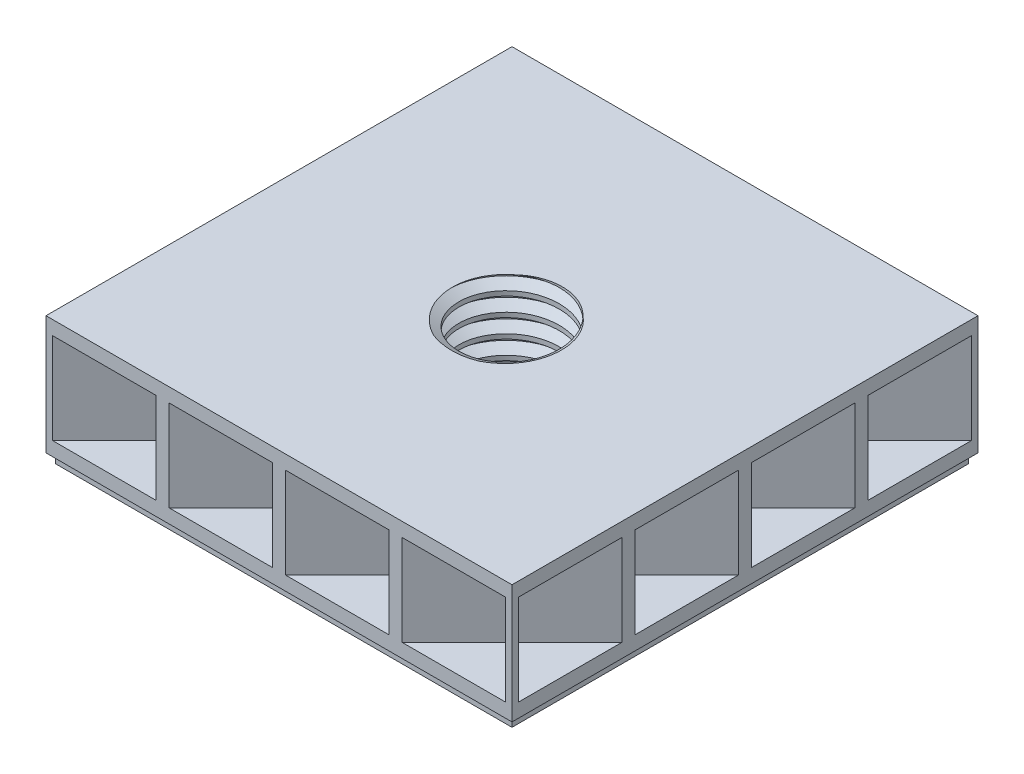
from build123d import *

# Parameters (mm, degrees)
SKETCH1_W                = 20
SKETCH1_H                = 20
SKETCH1_R                = 2.157
MAIN_SQUARE_DEPTH        = 5.5
ANTIWARPCUTS1_DEPTH      = 29.814059068
ANTIWARPCUTS1_DEPTH_BACK = 29.814059068
SKETCH2_W                = 0.2
SKETCH2_H                = 0.4
ANTIWARPCUTS2_DEPTH      = 29.814059068
ANTIWARPCUTS2_DEPTH_BACK = 29.814059068
SKETCH3_W                = 0.2
SKETCH3_H                = 0.4
NOFILL_DEPTH             = 29.814059068
NOFILL_DEPTH_BACK        = 29.814059068
SKETCH5_W                = 20
SKETCH5_H                = 3.9
THREADME_REACH           = 30.64
SKETCH6_R                = 4
SKETCH6_R_2              = 2.157
LATTICE_DEPTH            = 3.9
THREAD1_PITCH            = 0.8


with BuildPart() as part:
    # Sketch1 → Main Square (new body)
    with BuildSketch(Plane(origin=(0, 0, 0), x_dir=(1, 0, 0), z_dir=(0, 1, 0))):
        with Locations((10, 10)):
            Rectangle(SKETCH1_W, SKETCH1_H)
        with Locations(Location((10, 10, 0), (0, 0, 270))):
            Circle(SKETCH1_R, mode=Mode.SUBTRACT)
    extrude(amount=MAIN_SQUARE_DEPTH)

    # Sketch2 → AntiWarpCuts1 (cut, two sides: drawn at the far end of the back side and taken through both)
    with BuildSketch(Plane.XY.offset(-ANTIWARPCUTS1_DEPTH_BACK)):
        with Locations((0.1, 0.2)):
            Rectangle(SKETCH2_W, SKETCH2_H)
        with Locations((19.9, 0.2)):
            Rectangle(SKETCH2_W, SKETCH2_H)
    extrude(amount=ANTIWARPCUTS1_DEPTH + ANTIWARPCUTS1_DEPTH_BACK, mode=Mode.SUBTRACT)

    # Sketch3 → AntiWarpCuts2 (cut, two sides: drawn at the far end of the back side and taken through both)
    with BuildSketch(Plane.ZY.offset(-ANTIWARPCUTS2_DEPTH_BACK)):
        with Locations((-0.1, 0.2)):
            Rectangle(SKETCH3_W, SKETCH3_H)
        with Locations((-19.9, 0.2)):
            Rectangle(SKETCH3_W, SKETCH3_H)
    extrude(amount=ANTIWARPCUTS2_DEPTH + ANTIWARPCUTS2_DEPTH_BACK, mode=Mode.SUBTRACT)

    # Sketch5 → NoFill (cut, two sides: drawn at the far end of the back side and taken through both)
    with BuildSketch(Plane.ZY.offset(-NOFILL_DEPTH_BACK)):
        with Locations((-10, 2.95)):
            Rectangle(SKETCH5_W, SKETCH5_H)
    extrude(amount=NOFILL_DEPTH + NOFILL_DEPTH_BACK, mode=Mode.SUBTRACT)


with BuildPart() as nofill_piece_1:
    # of the separate pieces the step leaves, piece 1, a body of its own (nofill_pieces)
    add(part.part.solids().sort_by_distance((0, 0.4, 0))[0])


with BuildPart() as nofill_piece_2:
    # of the separate pieces the step leaves, piece 2, a body of its own (nofill_pieces)
    add(part.part.solids().sort_by_distance((0, 4.9, 0))[0])

    # Sketch6 → ThreadMe (add, up to next)
    with BuildSketch(Plane(origin=(0, 1, 0), x_dir=(1, 0, 0), z_dir=(0, 1, 0)), mode=Mode.PRIVATE) as threadme_sk1:
        with Locations(Location((10, 10, 0), (0, 0, 90))):
            Circle(SKETCH6_R)
        with Locations(Location((10, 10, 0), (0, 0, 270))):
            Circle(SKETCH6_R_2, mode=Mode.SUBTRACT)
    threadme_tool1 = extrude(threadme_sk1.sketch, amount=THREADME_REACH, mode=Mode.PRIVATE) - nofill_piece_2.part

    add(nofill_piece_1.part)  # ThreadMe merges NoFill piece 1
    add(threadme_tool1.solids().sort_by_distance((10, 1, -6.113137))[0])

    # Sketch7 → Lattice (add)
    with BuildSketch(Plane.XZ.offset(-4.9)):
        Polygon((2.5, -2.217157288), (0.282842712, 0), (0, 0), (0, -0.282842712), (2.217157288, -2.5), (0, -4.717157288), (0, -5.282842712), (2.217157288, -7.5), (0, -9.717157288), (0, -10.282842712), (2.217157288, -12.5), (0, -14.717157288), (0, -15.282842712), (2.217157288, -17.5), (0, -19.717157288), (0, -20), (0.282842712, -20), (2.5, -17.782842712), (4.717157288, -20), (5.282842712, -20), (7.5, -17.782842712), (9.717157288, -20), (10.282842712, -20), (12.5, -17.782842712), (14.717157288, -20), (15.282842712, -20), (17.5, -17.782842712), (19.717157288, -20), (20, -20), (20, -19.717157288), (17.782842712, -17.5), (20, -15.282842712), (20, -14.717157288), (17.782842712, -12.5), (20, -10.282842712), (20, -9.717157288), (17.782842712, -7.5), (20, -5.282842712), (20, -4.717157288), (17.782842712, -2.5), (20, -0.282842712), (20, 0), (19.717157288, 0), (17.5, -2.217157288), (15.282842712, 0), (14.717157288, 0), (12.5, -2.217157288), (10.282842712, 0), (9.717157288, 0), (7.5, -2.217157288), (5.282842712, 0), (4.717157288, 0), align=None)
        Polygon((2.782842712, -17.5), (5, -15.282842712), (7.217157288, -17.5), (5, -19.717157288), align=None, mode=Mode.SUBTRACT)
        Polygon((0.282842712, -15), (2.5, -12.782842712), (4.717157288, -15), (2.5, -17.217157288), align=None, mode=Mode.SUBTRACT)
        Polygon((7.782842712, -17.5), (10, -15.282842712), (12.217157288, -17.5), (10, -19.717157288), align=None, mode=Mode.SUBTRACT)
        Polygon((12.782842712, -17.5), (15, -15.282842712), (17.217157288, -17.5), (15, -19.717157288), align=None, mode=Mode.SUBTRACT)
        Polygon((15.282842712, -15), (17.5, -12.782842712), (19.717157288, -15), (17.5, -17.217157288), align=None, mode=Mode.SUBTRACT)
        Polygon((0.282842712, -10), (2.5, -7.782842712), (4.717157288, -10), (2.5, -12.217157288), align=None, mode=Mode.SUBTRACT)
        Polygon((0.282842712, -5), (2.5, -2.782842712), (4.717157288, -5), (2.5, -7.217157288), align=None, mode=Mode.SUBTRACT)
        Polygon((2.782842712, -2.5), (5, -0.282842712), (7.217157288, -2.5), (5, -4.717157288), align=None, mode=Mode.SUBTRACT)
        with BuildLine():
            Line((5.282842712, -5), (7.5, -2.782842712))
            Line((7.5, -2.782842712), (9.717157288, -5))
            Line((9.717157288, -5), (8.36996048, -6.347196807))
            ThreePointArc((8.36996048, -6.347196807), (8.778938462, -6.190930728), (9.20254492, -6.080297793))
            Line((9.20254492, -6.080297793), (10, -5.282842712))
            Line((10, -5.282842712), (10.79745508, -6.080297793))
            ThreePointArc((10.79745508, -6.080297793), (11.221061538, -6.190930728), (11.63003952, -6.347196807))
            Line((11.63003952, -6.347196807), (10.282842712, -5))
            Line((10.282842712, -5), (12.5, -2.782842712))
            Line((12.5, -2.782842712), (14.717157288, -5))
            Line((14.717157288, -5), (12.683468022, -7.033689265))
            ThreePointArc((12.683468022, -7.033689265), (12.828427125, -7.171572875), (12.966310735, -7.316531978))
            Line((12.966310735, -7.316531978), (15, -5.282842712))
            Line((15, -5.282842712), (17.217157288, -7.5))
            Line((17.217157288, -7.5), (15, -9.717157288))
            Line((15, -9.717157288), (13.652803193, -8.36996048))
            ThreePointArc((13.652803193, -8.36996048), (13.809069272, -8.778938462), (13.919702207, -9.20254492))
            Line((13.919702207, -9.20254492), (14.717157288, -10))
            Line((14.717157288, -10), (13.919702207, -10.79745508))
            ThreePointArc((13.919702207, -10.79745508), (13.809069272, -11.221061538), (13.652803193, -11.63003952))
            Line((13.652803193, -11.63003952), (15, -10.282842712))
            Line((15, -10.282842712), (17.217157288, -12.5))
            Line((17.217157288, -12.5), (15, -14.717157288))
            Line((15, -14.717157288), (12.966310735, -12.683468022))
            ThreePointArc((12.966310735, -12.683468022), (12.828427125, -12.828427125), (12.683468022, -12.966310735))
            Line((12.683468022, -12.966310735), (14.717157288, -15))
            Line((14.717157288, -15), (12.5, -17.217157288))
            Line((12.5, -17.217157288), (10.282842712, -15))
            Line((10.282842712, -15), (11.63003952, -13.652803193))
            ThreePointArc((11.63003952, -13.652803193), (11.221061538, -13.809069272), (10.79745508, -13.919702207))
            Line((10.79745508, -13.919702207), (10, -14.717157288))
            Line((10, -14.717157288), (9.20254492, -13.919702207))
            ThreePointArc((9.20254492, -13.919702207), (8.778938462, -13.809069272), (8.36996048, -13.652803193))
            Line((8.36996048, -13.652803193), (9.717157288, -15))
            Line((9.717157288, -15), (7.5, -17.217157288))
            Line((7.5, -17.217157288), (5.282842712, -15))
            Line((5.282842712, -15), (7.316531978, -12.966310735))
            ThreePointArc((7.316531978, -12.966310735), (7.171572875, -12.828427125), (7.033689265, -12.683468022))
            Line((7.033689265, -12.683468022), (5, -14.717157288))
            Line((5, -14.717157288), (2.782842712, -12.5))
            Line((2.782842712, -12.5), (5, -10.282842712))
            Line((5, -10.282842712), (6.347196807, -11.63003952))
            ThreePointArc((6.347196807, -11.63003952), (6.190930728, -11.221061538), (6.080297793, -10.79745508))
            Line((6.080297793, -10.79745508), (5.282842712, -10))
            Line((5.282842712, -10), (6.080297793, -9.20254492))
            ThreePointArc((6.080297793, -9.20254492), (6.190930728, -8.778938462), (6.347196807, -8.36996048))
            Line((6.347196807, -8.36996048), (5, -9.717157288))
            Line((5, -9.717157288), (2.782842712, -7.5))
            Line((2.782842712, -7.5), (5, -5.282842712))
            Line((5, -5.282842712), (7.033689265, -7.316531978))
            ThreePointArc((7.033689265, -7.316531978), (7.171572875, -7.171572875), (7.316531978, -7.033689265))
            Line((7.316531978, -7.033689265), (5.282842712, -5))
        make_face(mode=Mode.SUBTRACT)
        Polygon((15.282842712, -10), (17.5, -7.782842712), (19.717157288, -10), (17.5, -12.217157288), align=None, mode=Mode.SUBTRACT)
        Polygon((7.782842712, -2.5), (10, -0.282842712), (12.217157288, -2.5), (10, -4.717157288), align=None, mode=Mode.SUBTRACT)
        Polygon((12.782842712, -2.5), (15, -0.282842712), (17.217157288, -2.5), (15, -4.717157288), align=None, mode=Mode.SUBTRACT)
        Polygon((15.282842712, -5), (17.5, -2.782842712), (19.717157288, -5), (17.5, -7.217157288), align=None, mode=Mode.SUBTRACT)
    extrude(amount=LATTICE_DEPTH)

    # Thread1: arcs per turn and ends read off the stored shape
    # Thread1: the profile of Thread Profile1 profile screwed along a right-hand helix through 8.75 turns, 8 arcs to a turn; built about Z, then put on its axis
    thread1_z = Axis((0, 0, 0), (0, 0, 1))
    thread1_corners = [(2.1567, 0, -0.000173205), (2.5900127, 0, 0.249999999), (2.5900127, 0, 0.349999999), (2.1567, 0, 0.600173203)]
    with BuildLine(mode=Mode.PRIVATE) as thread1_profile:
        Line(thread1_corners[0], thread1_corners[1])
        Line(thread1_corners[1], thread1_corners[2])
        Line(thread1_corners[2], thread1_corners[3])
        Line(thread1_corners[3], thread1_corners[0])
    thread1_cap = Face(thread1_profile.wire())
    thread1_turn_angles = [0, 22.5, 45, 67.5, 90, 112.5, 135, 157.5, 180, 202.5, 225, 247.5, 270, 292.5, 315, 337.5, 360]
    thread1_turn_weights = [1, 0.9238795325112867, 1, 0.9238795325112867, 1, 0.9238795325112867, 1, 0.9238795325112867, 1, 0.9238795325112867, 1, 0.9238795325112867, 1, 0.9238795325112867, 1, 0.9238795325112867, 1]
    thread1_turn_rails = [Edge.make_bspline([Vector(p[0], p[1], 0).rotate(thread1_z, thread1_turn_angles[k]) / thread1_turn_weights[k] + Vector(0, 0, p[2] + THREAD1_PITCH * thread1_turn_angles[k] / 360) for k in range(17)], [0, 0, 0, 1, 1, 2, 2, 3, 3, 4, 4, 5, 5, 6, 6, 7, 7, 8, 8, 8], 2, thread1_turn_weights) for p in thread1_corners]
    thread1_turn_sides = [Face.make_surface_from_curves(thread1_turn_rails[p[0]], thread1_turn_rails[p[1]]) for p in [(0, 1), (1, 2), (2, 3), (3, 0)]]
    thread1_last_angles = [2880, 2902.5, 2925, 2947.5, 2970, 2992.5, 3015, 3037.5, 3060, 3082.5, 3105, 3127.5, 3150]
    thread1_last_weights = [1, 0.9238795325112867, 1, 0.9238795325112867, 1, 0.9238795325112867, 1, 0.9238795325112867, 1, 0.9238795325112867, 1, 0.9238795325112867, 1]
    thread1_last_rails = [Edge.make_bspline([Vector(p[0], p[1], 0).rotate(thread1_z, thread1_last_angles[k]) / thread1_last_weights[k] + Vector(0, 0, p[2] + THREAD1_PITCH * thread1_last_angles[k] / 360) for k in range(13)], [0, 0, 0, 1, 1, 2, 2, 3, 3, 4, 4, 5, 5, 6, 6, 6], 2, thread1_last_weights) for p in thread1_corners]
    thread1_last_sides = [Face.make_surface_from_curves(thread1_last_rails[p[0]], thread1_last_rails[p[1]]) for p in [(0, 1), (1, 2), (2, 3), (3, 0)]]
    thread1 = Plane(origin=(10, -1, -10), x_dir=(1, 0, 0), z_dir=(0, 1, 0)) * Solid(Shell([*[p.moved(Location((0, 0, THREAD1_PITCH * i))) for i in range(8) for p in thread1_turn_sides], *thread1_last_sides, thread1_cap, thread1_cap.rotate(thread1_z, 3150).moved(Location((0, 0, THREAD1_PITCH * 3150 / 360)))]))
    add(thread1, mode=Mode.SUBTRACT)


solid = nofill_piece_2.part
